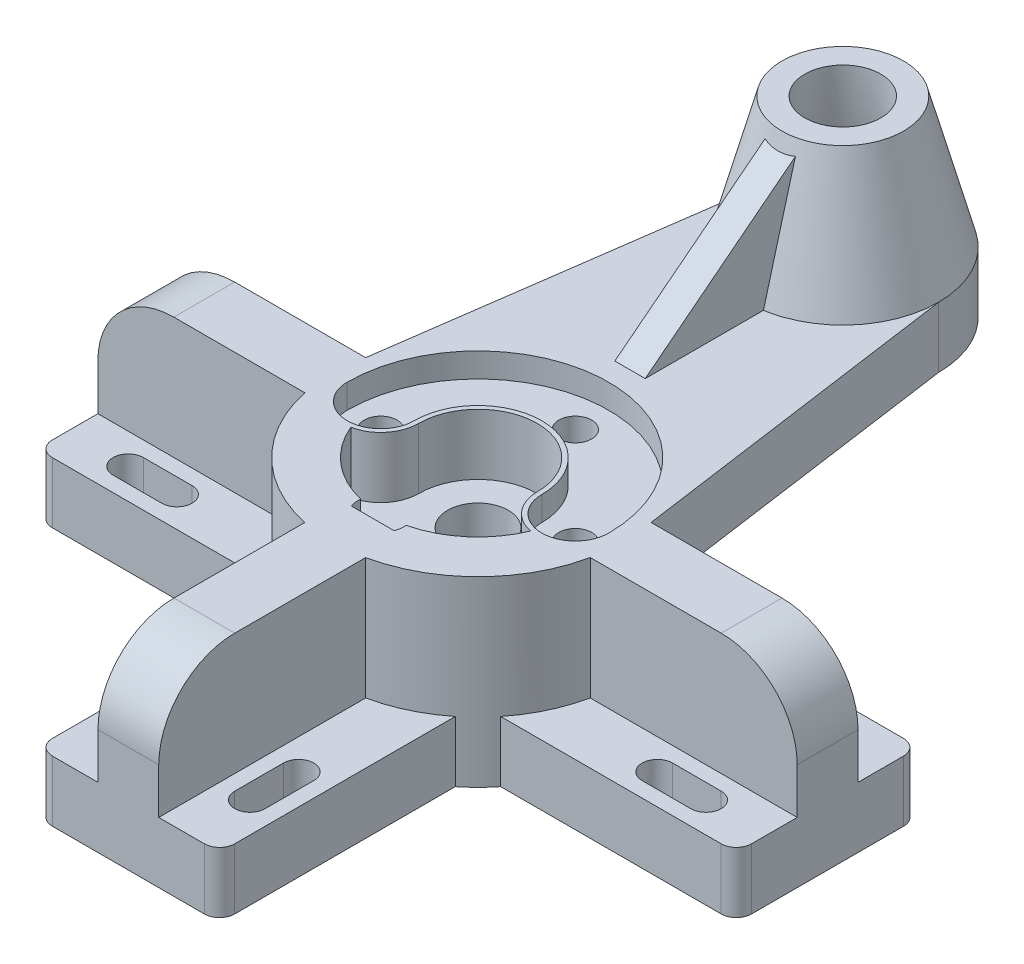
from build123d import *

# Parameters (mm, degrees)
SKETCH3_R            = 48
BOSS_EXTRUDE3_DEPTH  = 60
SKETCH4_R            = 10
CUT_EXTRUDE2_DEPTH   = 60
SKETCH5_R            = 32
CUT_EXTRUDE3_DEPTH   = 20
SKETCH6_R            = 7.5
CUT_EXTRUDE4_DEPTH   = 8
SKETCH7_R            = 7.5
CUT_EXTRUDE5_DEPTH   = 8
SKETCH8_R            = 5.4
CUT_EXTRUDE6_DEPTH   = 31.25
SKETCH9_W            = 60
SKETCH9_H            = 80.431117528
BOSS_EXTRUDE6_DEPTH  = 20
SKETCH10_W           = 20
SKETCH10_H           = 80.388981911
BOSS_EXTRUDE9_DEPTH  = 60
FILLET1_R            = 25
SKETCH11_W           = 80.343493664
SKETCH11_H           = 60
SKETCH11_W_2         = 80.608360626
BOSS_EXTRUDE10_DEPTH = 20
SKETCH12_W           = 77.194012243
SKETCH12_H           = 20
SKETCH12_W_2         = 74.672808446
BOSS_EXTRUDE11_DEPTH = 60
FILLET2_R            = 25
FILLET3_R            = 25
CUT_EXTRUDE7_DEPTH   = 20
CUT_EXTRUDE8_DEPTH   = 20
CUT_EXTRUDE9_DEPTH   = 20
CUT_EXTRUDE10_DEPTH  = 20
CUT_EXTRUDE11_DEPTH  = 20
CUT_EXTRUDE12_DEPTH  = 20
BOSS_EXTRUDE12_START = -20
BOSS_EXTRUDE12_DEPTH = 20
FILLET4_R            = 5
FILLET5_R            = 5
FILLET6_R            = 5
FILLET7_R            = 5
FILLET8_R            = 5
FILLET9_R            = 5
BOSS_EXTRUDE14_DEPTH = 20
CUT_EXTRUDE15_DEPTH  = 8
SKETCH43_R           = 5.4
CUT_EXTRUDE16_DEPTH  = 31.25
SKETCH45_R           = 31.5
SKETCH44_R           = 20
RIB4_REACH           = 218.314
SKETCH48_WALL_W      = 496.36361957
SKETCH48_WALL_H      = 10


with BuildPart() as part:
    # Sketch3 → Boss-Extrude3 (new body)
    with BuildSketch(Plane(origin=(0, 0, 0), x_dir=(1, 0, 0), z_dir=(0, 1, 0))):
        with Locations(Location((0, 0, 0), (0, 0, 270))):
            Circle(SKETCH3_R)
    extrude(amount=BOSS_EXTRUDE3_DEPTH)

    # Sketch4 → Cut-Extrude2 (cut)
    with BuildSketch(Plane(origin=(0, 60, 0), x_dir=(1, 0, 0), z_dir=(0, 1, 0))):
        with Locations(Location((0, 0, 0), (0, 0, 270))):
            Circle(SKETCH4_R)
    extrude(amount=-CUT_EXTRUDE2_DEPTH, mode=Mode.SUBTRACT)

    # Sketch5 → Cut-Extrude3 (cut)
    with BuildSketch(Plane(origin=(0, 60, 0), x_dir=(1, 0, 0), z_dir=(0, 1, 0))):
        with Locations(Location((0, 0, 0), (0, 0, 270))):
            Circle(SKETCH5_R)
    extrude(amount=-CUT_EXTRUDE3_DEPTH, mode=Mode.SUBTRACT)

    # Sketch6 → Cut-Extrude4 (cut)
    with BuildSketch(Plane(origin=(0, 60, 0), x_dir=(1, 0, 0), z_dir=(0, 1, 0))):
        with Locations((0, 32)):
            Circle(SKETCH6_R)
    cut_extrude4 = extrude(amount=-CUT_EXTRUDE4_DEPTH, mode=Mode.SUBTRACT)

    # Mirror1: Cut-Extrude4 across plane
    add(cut_extrude4.mirror(Plane.XY), mode=Mode.SUBTRACT)

    # Sketch7 → Cut-Extrude5 (cut)
    with BuildSketch(Plane(origin=(0, 60, 0), x_dir=(1, 0, 0), z_dir=(0, 1, 0))):
        with Locations((-32, 0)):
            Circle(SKETCH7_R)
    cut_extrude5 = extrude(amount=-CUT_EXTRUDE5_DEPTH, mode=Mode.SUBTRACT)

    # Mirror2: Cut-Extrude5 across plane
    add(cut_extrude5.mirror(Plane(origin=(0, 0, 0), x_dir=(0, 0, 1), z_dir=(1, 0, 0))), mode=Mode.SUBTRACT)

    # Sketch8 → Cut-Extrude6 (cut)
    with BuildSketch(Plane(origin=(0, 52, 0), x_dir=(1, 0, 0), z_dir=(0, 1, 0))):
        with Locations(Location((0, 32, 0), (0, 0, 270))):
            Circle(SKETCH8_R)
        with Locations(Location((32, 0, 0), (0, 0, 270))):
            Circle(SKETCH8_R)
        with Locations(Location((-32, 0, 0), (0, 0, 270))):
            Circle(SKETCH8_R)
        with Locations(Location((0, -32, 0), (0, 0, 270))):
            Circle(SKETCH8_R)
    extrude(amount=-CUT_EXTRUDE6_DEPTH, mode=Mode.SUBTRACT)

    # Sketch9 → Boss-Extrude6 (add)
    with BuildSketch(Plane.XZ):
        with Locations((0, 74.784441236)):
            Rectangle(SKETCH9_W, SKETCH9_H)
    extrude(amount=-BOSS_EXTRUDE6_DEPTH)

    # Sketch10 → Boss-Extrude9 (add)
    with BuildSketch(Plane.XZ):
        with Locations((0, 74.805509045)):
            Rectangle(SKETCH10_W, SKETCH10_H)
    extrude(amount=-BOSS_EXTRUDE9_DEPTH)

    # Fillet1
    fillet1_edges = [part.edges().sort_by_distance(p)[0] for p in [
        (0, 60, 115),
    ]]
    fillet(fillet1_edges, radius=FILLET1_R)

    # Sketch11 → Boss-Extrude10 (add)
    with BuildSketch(Plane.XZ):
        with Locations((-74.852391579, 0)):
            Rectangle(SKETCH11_W, SKETCH11_H)
        with Locations((74.695819687, 0)):
            Rectangle(SKETCH11_W_2, SKETCH11_H)
    extrude(amount=-BOSS_EXTRUDE10_DEPTH)

    # Sketch12 → Boss-Extrude11 (add)
    with BuildSketch(Plane.XZ):
        with Locations((-76.42713229, 0)):
            Rectangle(SKETCH12_W, SKETCH12_H)
        with Locations((77.663595777, 0)):
            Rectangle(SKETCH12_W_2, SKETCH12_H)
    extrude(amount=-BOSS_EXTRUDE11_DEPTH)

    # Fillet2
    fillet2_edges = [part.edges().sort_by_distance(p)[0] for p in [
        (-115.024138411, 60, 0),
    ]]
    fillet(fillet2_edges, radius=FILLET2_R)

    # Fillet3
    fillet3_edges = [part.edges().sort_by_distance(p)[0] for p in [
        (115, 60, 0),
    ]]
    fillet(fillet3_edges, radius=FILLET3_R)

    # Sketch13 → Cut-Extrude7 (cut)
    with BuildSketch(Plane(origin=(0, 20, 0), x_dir=(1, 0, 0), z_dir=(0, 1, 0))):
        with BuildLine():
            Line((15, -95), (15, -79))
            ThreePointArc((15, -79), (20, -74), (25, -79))
            Line((25, -79), (25, -95))
            ThreePointArc((25, -95), (20, -100), (15, -95))
        make_face()
    cut_extrude7 = extrude(amount=-CUT_EXTRUDE7_DEPTH, mode=Mode.SUBTRACT)

    # Mirror7: Cut-Extrude7 across plane
    add(cut_extrude7.mirror(Plane.ZX.offset(20)), mode=Mode.SUBTRACT)

    # Sketch15 → Cut-Extrude8 (cut)
    with BuildSketch(Plane(origin=(0, 20, 0), x_dir=(1, 0, 0), z_dir=(0, 1, 0))):
        with BuildLine():
            Line((-15, -79), (-15, -95))
            ThreePointArc((-15, -95), (-20, -100), (-25, -95))
            Line((-25, -95), (-25, -79))
            ThreePointArc((-25, -79), (-20, -74), (-15, -79))
        make_face()
    extrude(amount=-CUT_EXTRUDE8_DEPTH, mode=Mode.SUBTRACT)

    # Sketch17 → Cut-Extrude9 (cut)
    with BuildSketch(Plane(origin=(0, 20, 0), x_dir=(1, 0, 0), z_dir=(0, 1, 0))):
        with BuildLine():
            Line((-95.024138411, -15), (-79.024138411, -15))
            ThreePointArc((-79.024138411, -15), (-74.024138411, -20), (-79.024138411, -25))
            Line((-79.024138411, -25), (-95.024138411, -25))
            ThreePointArc((-95.024138411, -25), (-100.024138411, -20), (-95.024138411, -15))
        make_face()
    extrude(amount=-CUT_EXTRUDE9_DEPTH, mode=Mode.SUBTRACT)

    # Sketch18 → Cut-Extrude10 (cut)
    with BuildSketch(Plane(origin=(0, 20, 0), x_dir=(1, 0, 0), z_dir=(0, 1, 0))):
        with BuildLine():
            Line((-95.024138411, 25), (-79.024138411, 25))
            ThreePointArc((-79.024138411, 25), (-74.024138411, 20), (-79.024138411, 15))
            Line((-79.024138411, 15), (-95.024138411, 15))
            ThreePointArc((-95.024138411, 15), (-100.024138411, 20), (-95.024138411, 25))
        make_face()
    extrude(amount=-CUT_EXTRUDE10_DEPTH, mode=Mode.SUBTRACT)

    # Sketch19 → Cut-Extrude11 (cut)
    with BuildSketch(Plane(origin=(0, 20, 0), x_dir=(1, 0, 0), z_dir=(0, 1, 0))):
        with BuildLine():
            Line((79, 25), (95, 25))
            ThreePointArc((95, 25), (100, 20), (95, 15))
            Line((95, 15), (79, 15))
            ThreePointArc((79, 15), (74, 20), (79, 25))
        make_face()
    extrude(amount=-CUT_EXTRUDE11_DEPTH, mode=Mode.SUBTRACT)

    # Sketch20 → Cut-Extrude12 (cut)
    with BuildSketch(Plane(origin=(0, 20, 0), x_dir=(1, 0, 0), z_dir=(0, 1, 0))):
        with BuildLine():
            Line((79, -15), (95, -15))
            ThreePointArc((95, -15), (100, -20), (95, -25))
            Line((95, -25), (79, -25))
            ThreePointArc((79, -25), (74, -20), (79, -15))
        make_face()
    extrude(amount=-CUT_EXTRUDE12_DEPTH, mode=Mode.SUBTRACT)

    # Sketch21 → Boss-Extrude12 (add)
    with BuildSketch(Plane(origin=(0, 60, 0), x_dir=(1, 0, 0), z_dir=(0, 1, 0)).offset(BOSS_EXTRUDE12_START)):
        with BuildLine():
            ThreePointArc((-46.946778377, 10), (0, 48), (46.946778377, 10))
            Line((46.946778377, 10), (31.5, 120))
            ThreePointArc((31.5, 120), (0, 151.5), (-31.5, 120))
            Line((-31.5, 120), (-46.946778377, 10))
        make_face()
    extrude(amount=BOSS_EXTRUDE12_DEPTH)

    # Fillet4
    fillet4_edges = [part.edges().sort_by_distance(p)[0] for p in [
        (-30, 10, 115),
    ]]
    fillet(fillet4_edges, radius=FILLET4_R)

    # Fillet5
    fillet5_edges = [part.edges().sort_by_distance(p)[0] for p in [
        (30, 10, 115),
    ]]
    fillet(fillet5_edges, radius=FILLET5_R)

    # Fillet6
    fillet6_edges = [part.edges().sort_by_distance(p)[0] for p in [
        (115, 10, 30),
    ]]
    fillet(fillet6_edges, radius=FILLET6_R)

    # Fillet7
    fillet7_edges = [part.edges().sort_by_distance(p)[0] for p in [
        (115, 10, -30),
    ]]
    fillet(fillet7_edges, radius=FILLET7_R)

    # Fillet8
    fillet8_edges = [part.edges().sort_by_distance(p)[0] for p in [
        (-115.024138411, 10, 30),
    ]]
    fillet(fillet8_edges, radius=FILLET8_R)

    # Fillet9
    fillet9_edges = [part.edges().sort_by_distance(p)[0] for p in [
        (-115.024138411, 10, -30),
        (-37.46998799, 10, -30),
    ]]
    fillet(fillet9_edges, radius=FILLET9_R)

    # Sketch39 → Boss-Extrude14 (add)
    with BuildSketch(Plane(origin=(0, 60, 0), x_dir=(1, 0, 0), z_dir=(0, 1, 0))):
        with BuildLine():
            ThreePointArc((44.5, 0), (0, 44.5), (-44.5, 0))
            ThreePointArc((-44.5, 0), (-32, -12.5), (-19.5, 0))
            ThreePointArc((-19.5, 0), (0, 19.5), (19.5, 0))
            ThreePointArc((19.5, 0), (32, -12.5), (44.5, 0))
        make_face()
    extrude(amount=-BOSS_EXTRUDE14_DEPTH)

    # Sketch41 → Cut-Extrude15 (cut)
    with BuildSketch(Plane(origin=(0, 60, 0), x_dir=(1, 0, 0), z_dir=(0, 1, 0))):
        with BuildLine():
            ThreePointArc((43, 0), (0, 43), (-43, 0))
            ThreePointArc((-43, 0), (-32, -11), (-21, 0))
            ThreePointArc((-21, 0), (0, 21), (21, 0))
            ThreePointArc((21, 0), (32, -11), (43, 0))
        make_face()
    extrude(amount=-CUT_EXTRUDE15_DEPTH, mode=Mode.SUBTRACT)

    # Sketch43 → Cut-Extrude16 (cut)
    with BuildSketch(Plane(origin=(0, 60, 0), x_dir=(1, 0, 0), z_dir=(0, 1, 0))):
        with Locations(Location((0, 32, 0), (0, 0, 270))):
            Circle(SKETCH43_R)
        with Locations(Location((32, 0, 0), (0, 0, 270))):
            Circle(SKETCH43_R)
        with Locations(Location((-32, 0, 0), (0, 0, 270))):
            Circle(SKETCH43_R)
    extrude(amount=-CUT_EXTRUDE16_DEPTH, mode=Mode.SUBTRACT)

    # Sketch45 → Loft1 section 0
    with BuildSketch(Plane(origin=(0, 60, 0), x_dir=(1, 0, 0), z_dir=(0, 1, 0))):
        with Locations((0, 120)):
            Circle(SKETCH45_R)
    # Sketch44 → Loft1 section 1
    with BuildSketch(Plane(origin=(0, 103, 0), x_dir=(1, 0, 0), z_dir=(0, 1, 0))):
        with Locations((0, 120)):
            Circle(SKETCH44_R)
    loft()

    # Cut-Loft1: read off the stored shape, not the designer's step
    # Cut-Loft1: loft between two sections, ruled curve by curve
    cut_loft1_from = [
        Edge.make_bspline([(-18.577469115, 40, -107.306393685), (6.809743514, 40, -70.151455455), (43.964681745, 40, -95.538668084), (18.577469115, 40, -132.693606315), (-6.809743514, 40, -169.848544545), (-43.964681745, 40, -144.461331916), (-18.577469115, 40, -107.306393685)], [0, 0, 0, 0, 0.5, 0.5, 0.5, 1, 1, 1, 1], 3, [1, 0.333333333, 0.333333333, 1, 0.333333333, 0.333333333, 1]),
    ]
    cut_loft1_to = [
        Edge.make_bspline([(0, 103, -107.5), (25, 103, -107.5), (25, 103, -132.5), (0, 103, -132.5), (-25, 103, -132.5), (-25, 103, -107.5), (0, 103, -107.5)], [0, 0, 0, 0, 0.5, 0.5, 0.5, 1, 1, 1, 1], 3, [1, 0.333333333, 0.333333333, 1, 0.333333333, 0.333333333, 1]),
    ]
    cut_loft1 = Solid(Shell([*[Face.make_surface_from_curves(cut_loft1_from[k], cut_loft1_to[k]) for k in range(1)], Face(Wire(cut_loft1_from)), Face(Wire(cut_loft1_to))]))
    add(cut_loft1, mode=Mode.SUBTRACT)

    # Sketch48 wall → Rib4 (add, up to next)
    with BuildSketch(Plane(origin=(0, 79.004041802, -74.34088831), x_dir=(0, -0.615661475323, 0.788010753609), z_dir=(0, -0.788010753609, -0.615661475323)), mode=Mode.PRIVATE) as rib4_sk1:
        Rectangle(SKETCH48_WALL_W, SKETCH48_WALL_H)
    rib4_tool1 = extrude(rib4_sk1.sketch, amount=RIB4_REACH, mode=Mode.PRIVATE) - part.part
    add(rib4_tool1.solids().sort_by_distance((0, 79.004041802, -74.34088831))[0])


solid = part.part
